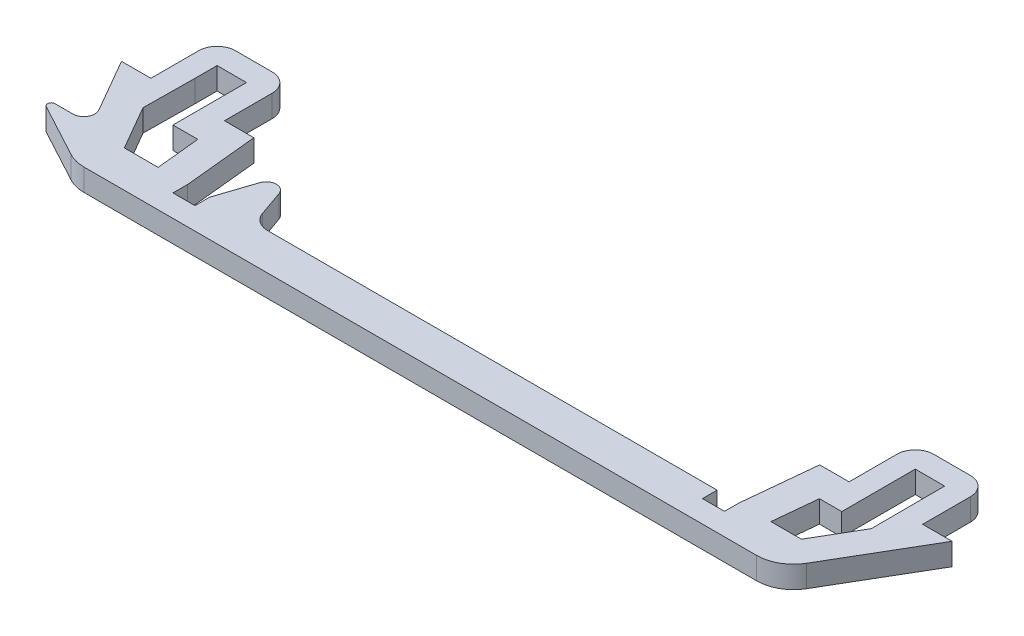
from build123d import *

# Parameters (mm, degrees)
BOSS_EXTRUDE1_DEPTH = 3
FILLET1_R           = 5
FILLET2_R           = 2.5
FILLET3_R           = 2.5


with BuildPart() as part:
    # Sketch1 → Boss-Extrude1 (new body)
    with BuildSketch(Plane(origin=(0, 0, 0), x_dir=(1, 0, 0), z_dir=(0, 1, 0))):
        with BuildLine():
            Line((-62.418566214, -47.1586621), (-58.418566214, -47.1586621))
            Line((-58.418566214, -47.1586621), (-58.418566214, -38.1586621))
            Line((-58.418566214, -38.1586621), (-48.418566214, -38.1586621))
            Line((-48.418566214, -38.1586621), (-48.418566214, -47.1586621))
            Line((-48.418566214, -47.1586621), (-44.418566214, -47.1586621))
            Line((-44.418566214, -47.1586621), (-43.418817081, -57.156153425))
            Line((-43.418817081, -57.156153425), (-43.418817081, -59.1586621))
            Line((-43.418817081, -59.1586621), (-40.418817081, -59.1586621))
            Line((-40.418817081, -59.1586621), (-40.418817081, -57.1586621))
            Line((-40.418817081, -57.1586621), (-38.722684913, -52.044656797))
            ThreePointArc((-38.722684913, -52.044656797), (-37.43326006, -51.106013311), (-36.129099744, -52.024073178))
            Line((-36.129099744, -52.024073178), (-34.335191263, -57.1586621))
            Line((-34.335191263, -57.1586621), (28.581433786, -57.1586621))
            Line((28.581433786, -57.1586621), (28.581433786, -59.1586621))
            Line((28.581433786, -59.1586621), (31.581433786, -59.1586621))
            Line((31.581433786, -59.1586621), (31.581433786, -57.208800497))
            Line((31.581433786, -57.208800497), (32.581433786, -47.211334262))
            Line((32.581433786, -47.211334262), (36.581433786, -47.211334262))
            Line((36.581433786, -47.211334262), (36.581433786, -38.211334262))
            Line((36.581433786, -38.211334262), (46.581433786, -38.211334262))
            Line((46.581433786, -38.211334262), (46.581433786, -47.211334262))
            Line((46.581433786, -47.211334262), (50.581433786, -47.211334262))
            Line((50.581433786, -47.211334262), (41.830582941, -62.1586621))
            Line((41.830582941, -62.1586621), (-53.758312176, -62.1586621))
            Line((-53.758312176, -62.1586621), (-62.202371167, -57.610709304))
            ThreePointArc((-62.202371167, -57.610709304), (-62.450096964, -57.048239346), (-61.965274707, -56.670498822))
            Line((-61.965274707, -56.670498822), (-59.524980934, -56.670498822))
            ThreePointArc((-59.524980934, -56.670498822), (-58.225942828, -55.920498822), (-58.225942828, -54.420498822))
            Line((-58.225942828, -54.420498822), (-62.418566214, -47.1586621))
        make_face()
        Polygon((36.547763078, -51.211334262), (39.581433786, -51.211334262), (39.581433786, -44.211334262), (39.581433786, -41.211334262), (43.581433786, -41.211334262), (43.581433786, -44.211334262), (43.604572315, -51.211334262), (40.093380681, -57.208800497), (35.947864455, -57.208800497), align=None, mode=Mode.SUBTRACT)
        Polygon((-55.418566214, -41.1586621), (-51.418566214, -41.1586621), (-51.418566214, -44.1586621), (-51.418566214, -51.1586621), (-48.038516462, -51.1586621), (-47.438516462, -57.1586621), (-52.026261368, -57.1586621), (-55.490362984, -51.1586621), (-55.418566214, -44.1586621), align=None, mode=Mode.SUBTRACT)
    extrude(amount=BOSS_EXTRUDE1_DEPTH)

    # Fillet1
    fillet1_edges = [part.edges().sort_by_distance(p)[0] for p in [
        (41.830582941, 1.5, 62.1586621),
        (-53.758312176, 1.5, 62.1586621),
    ]]
    fillet(fillet1_edges, radius=FILLET1_R)

    # Fillet2
    fillet2_edges = [part.edges().sort_by_distance(p)[0] for p in [
        (46.581433786, 1.5, 38.211334262),
        (36.581433786, 1.5, 38.211334262),
        (-58.418566214, 1.5, 38.1586621),
        (-48.418566214, 1.5, 38.1586621),
    ]]
    fillet(fillet2_edges, radius=FILLET2_R)

    # Fillet3
    fillet3_edges = [part.edges().sort_by_distance(p)[0] for p in [
        (-34.335191263, 1.5, 57.1586621),
    ]]
    fillet(fillet3_edges, radius=FILLET3_R)


solid = part.part
